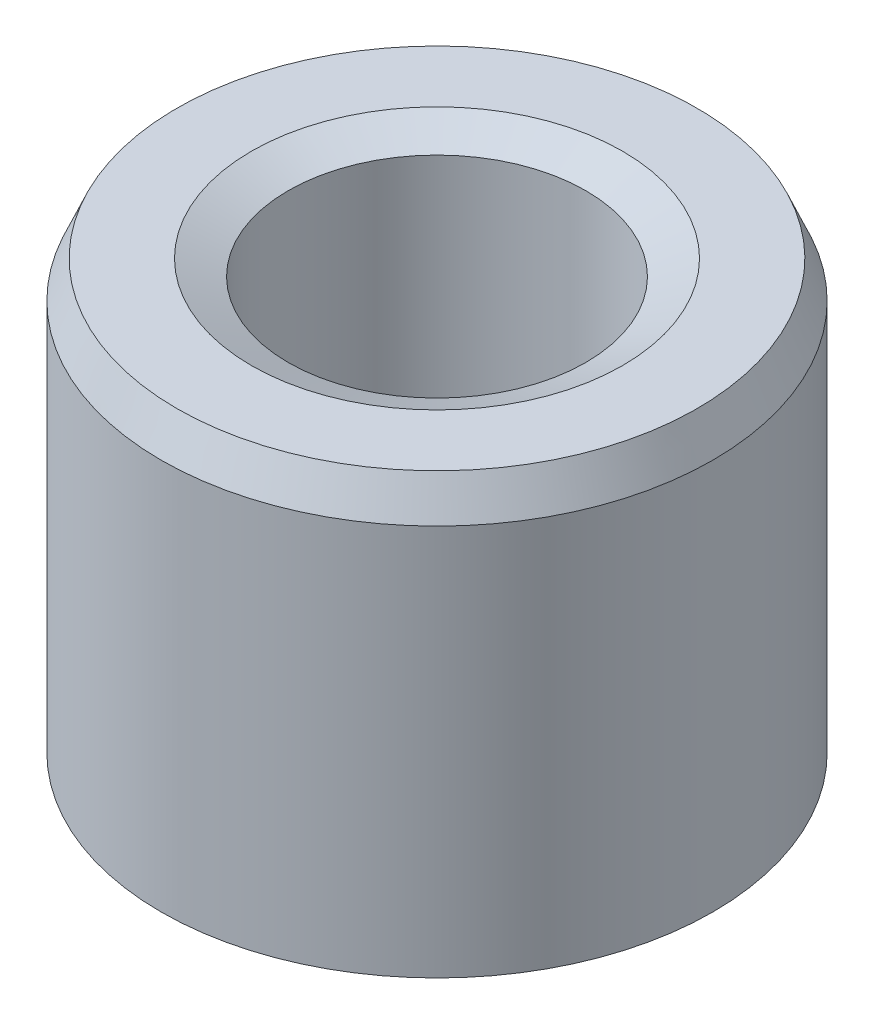
from build123d import *
from OCP.BRepFilletAPI import BRepFilletAPI_MakeChamfer

# Parameters (mm, degrees)
SKETCH1_R           = 22.5
BOSS_EXTRUDE1_DEPTH = 36.2004482
SKETCH2_R           = 12.138668866
CUT_EXTRUDE1_DEPTH  = 49.197224504
CHAMFER1_SIZE       = 3.001257864
CHAMFER1_SIZE2      = 1.284173313


with BuildPart() as part:
    # Sketch1 → Boss-Extrude1 (new body)
    with BuildSketch(Plane(origin=(0, 0, 0), x_dir=(1, 0, 0), z_dir=(0, 1, 0))):
        Circle(SKETCH1_R)
    extrude(amount=BOSS_EXTRUDE1_DEPTH)

    # Sketch2 → Cut-Extrude1 (cut, through all)
    with BuildSketch(Plane(origin=(0, 0, 0), x_dir=(1, 0, 0), z_dir=(0, 1, 0))):
        Circle(SKETCH2_R)
    extrude(amount=CUT_EXTRUDE1_DEPTH, mode=Mode.SUBTRACT)

    # Chamfer1: one chamfer whose edges measure the first distance from different faces: ONE call of the kernel's chamfer builder (chamfer() names one face for all edges)
    chamfer1_edges_1 = [part.edges().sort_by_distance(p)[0] for p in [
        (-12.138668866, 36.2004482, 0),
    ]]
    chamfer1_side_1 = [part.faces().sort_by_distance(p)[0] for p in [
        (-21.863603897, 36.2004482, 0),
    ]]
    chamfer1_edges_2 = [part.edges().sort_by_distance(p)[0] for p in [
        (-12.138668866, 0, 0),
    ]]
    chamfer1_side_2 = [part.faces().sort_by_distance(p)[0] for p in [
        (-12.138668866, 18.1002241, 0),
    ]]
    chamfer1_edges_3 = [part.edges().sort_by_distance(p)[0] for p in [
        (-22.5, 0, 0),
    ]]
    chamfer1_side_3 = [part.faces().sort_by_distance(p)[0] for p in [
        (-21.863603897, 0, 0),
    ]]
    chamfer1_edges_4 = [part.edges().sort_by_distance(p)[0] for p in [
        (-22.5, 36.2004482, 0),
    ]]
    chamfer1_side_4 = [part.faces().sort_by_distance(p)[0] for p in [
        (-22.5, 18.1002241, 0),
    ]]
    chamfer1 = BRepFilletAPI_MakeChamfer(part.part.solid().wrapped)
    for e in chamfer1_edges_1:
        chamfer1.Add(CHAMFER1_SIZE, CHAMFER1_SIZE2, e.wrapped, chamfer1_side_1[0].wrapped)  # the first distance lies on this face
    for e in chamfer1_edges_2:
        chamfer1.Add(CHAMFER1_SIZE, CHAMFER1_SIZE2, e.wrapped, chamfer1_side_2[0].wrapped)  # the first distance lies on this face
    for e in chamfer1_edges_3:
        chamfer1.Add(CHAMFER1_SIZE, CHAMFER1_SIZE2, e.wrapped, chamfer1_side_3[0].wrapped)  # the first distance lies on this face
    for e in chamfer1_edges_4:
        chamfer1.Add(CHAMFER1_SIZE, CHAMFER1_SIZE2, e.wrapped, chamfer1_side_4[0].wrapped)  # the first distance lies on this face
    add(Compound.cast(chamfer1.Shape()), mode=Mode.REPLACE)


solid = part.part
